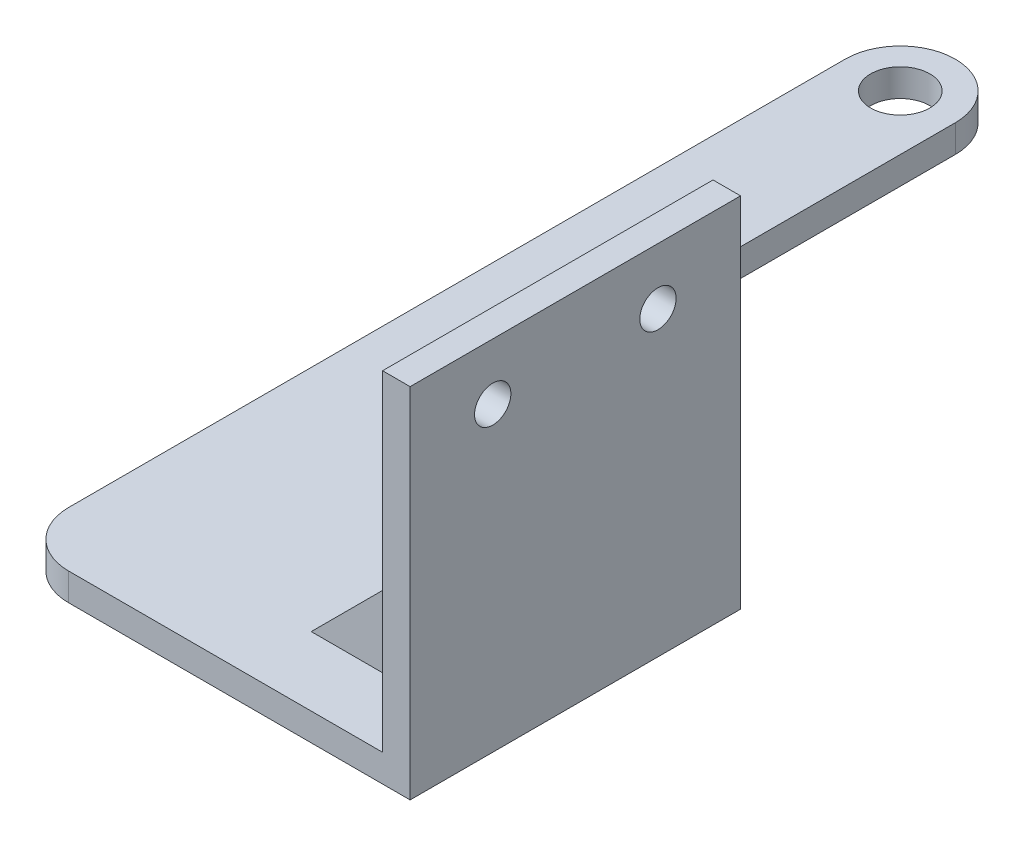
from build123d import *

# Parameters (mm, degrees)
BOSS_EXTRUDE1_DEPTH = 60
SKETCH3_W           = 60
SKETCH3_H           = 5
BOSS_EXTRUDE2_DEPTH = 67
SKETCH4_W           = 20
SKETCH4_H           = 5
BOSS_EXTRUDE3_DEPTH = 101
CUT_EXTRUDE1_REACH  = 139.786
SKETCH6_R           = 5.375
CUT_EXTRUDE2_REACH  = 139.532
SKETCH11_R          = 3.3
FILLET1_R           = 10
FILLET3_R           = 10
FILLET4_R           = 10
BOSS_EXTRUDE4_DEPTH = 2.5


with BuildPart() as part:
    # Sketch1 → Boss-Extrude1 (new body)
    with BuildSketch(Plane.XY):
        Polygon((-5, 0), (-5, -50), (-5, -65), (0, -65), (0, 0), align=None)
    extrude(amount=BOSS_EXTRUDE1_DEPTH)

    # Sketch3 → Boss-Extrude2 (add)
    with BuildSketch(Plane.ZY.offset(5)):
        with Locations((30, -62.5)):
            Rectangle(SKETCH3_W, SKETCH3_H)
    extrude(amount=BOSS_EXTRUDE2_DEPTH)

    # Sketch4 → Boss-Extrude3 (add)
    with BuildSketch(Plane(origin=(0, 0, 0), x_dir=(-1, 0, 0), z_dir=(0, 0, -1))):
        with Locations((62, -62.5)):
            Rectangle(SKETCH4_W, SKETCH4_H)
    extrude(amount=BOSS_EXTRUDE3_DEPTH)

    # Sketch6 → Cut-Extrude1 (cut, up to next)
    with BuildSketch(Plane(origin=(0, -60, 0), x_dir=(1, 0, 0), z_dir=(0, 1, 0)), mode=Mode.PRIVATE) as cut_extrude1_sk1:
        with Locations(Location((-62, 91, 0), (0, 0, 270))):
            Circle(SKETCH6_R)
    cut_extrude1_tool1 = extrude(cut_extrude1_sk1.sketch, amount=-CUT_EXTRUDE1_REACH, mode=Mode.PRIVATE) & part.part
    add(cut_extrude1_tool1.solids().sort_by_distance((-62, -60, -91))[0], mode=Mode.SUBTRACT)

    # Sketch11 → Cut-Extrude2 (cut, up to next)
    with BuildSketch(Plane.ZY.offset(5), mode=Mode.PRIVATE) as cut_extrude2_sk1:
        with Locations(Location((15, -10.25, 0), (0, 0, 270))):
            Circle(SKETCH11_R)
    cut_extrude2_tool1 = extrude(cut_extrude2_sk1.sketch, amount=-CUT_EXTRUDE2_REACH, mode=Mode.PRIVATE) & part.part
    # Sketch11 → Cut-Extrude2 (cut, up to next)
    with BuildSketch(Plane.ZY.offset(5), mode=Mode.PRIVATE) as cut_extrude2_sk2:
        with Locations(Location((45, -10.25, 0), (0, 0, 270))):
            Circle(SKETCH11_R)
    cut_extrude2_tool2 = extrude(cut_extrude2_sk2.sketch, amount=-CUT_EXTRUDE2_REACH, mode=Mode.PRIVATE) & part.part
    add(cut_extrude2_tool1.solids().sort_by_distance((-5, -10.25, 15))[0], mode=Mode.SUBTRACT)
    add(cut_extrude2_tool2.solids().sort_by_distance((-5, -10.25, 45))[0], mode=Mode.SUBTRACT)

    # Fillet1
    fillet1_edges = [part.edges().sort_by_distance(p)[0] for p in [
        (-52, -62.5, -101),
        (-72, -62.5, -101),
    ]]
    fillet(fillet1_edges, radius=FILLET1_R - 0.0001)  # a hair under: the kernel refuses the full size

    # Fillet3
    fillet3_edges = [part.edges().sort_by_distance(p)[0] for p in [
        (-52, -62.5, 0),
    ]]
    fillet(fillet3_edges, radius=FILLET3_R)

    # Fillet4
    fillet4_edges = [part.edges().sort_by_distance(p)[0] for p in [
        (-72, -62.5, 60),
    ]]
    fillet(fillet4_edges, radius=FILLET4_R)

    # Sketch13 → Boss-Extrude4 (add, symmetric)
    with BuildSketch(Plane.XY.offset(45)):
        Polygon((-30.455844123, -60), (-5, -34.544155877), (-5, -60), align=None)
    boss_extrude4 = extrude(amount=BOSS_EXTRUDE4_DEPTH, both=True)

    # Mirror1: Boss-Extrude4 across plane
    add(boss_extrude4.mirror(Plane.XY.offset(30)))


solid = part.part
